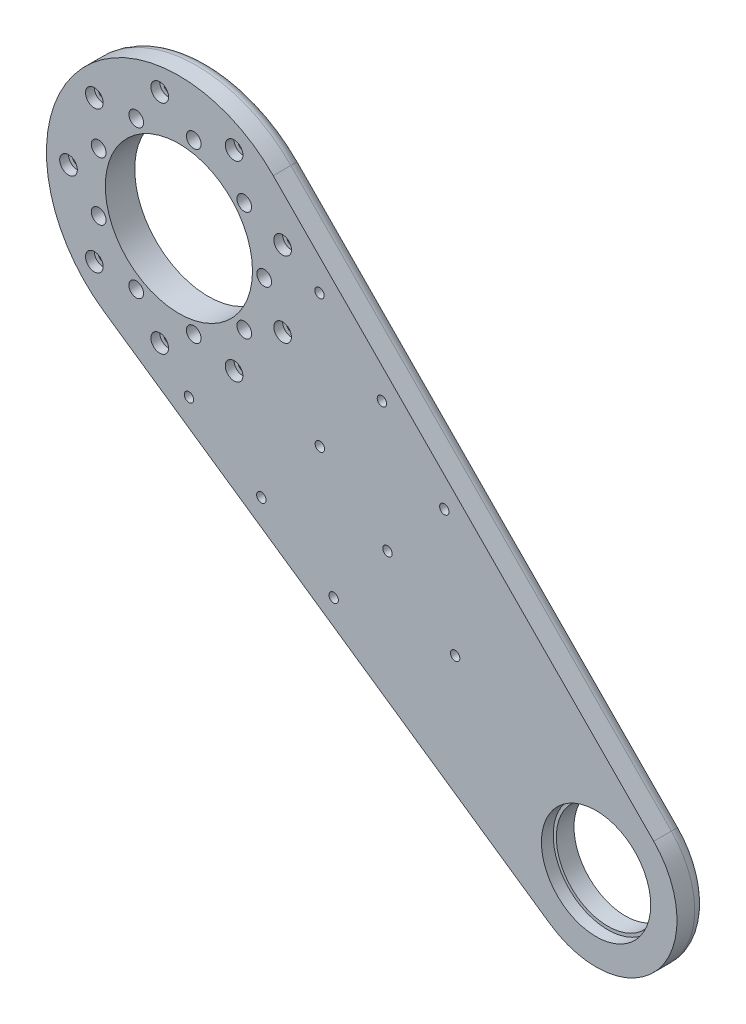
from build123d import *

# Parameters (mm, degrees)
SKETCH1_R           = 17.5
SKETCH1_R_2         = 1.6
BOSS_EXTRUDE1_DEPTH = 10
SKETCH2_R           = 25
SKETCH2_R_2         = 2.5
SKETCH2_R_3         = 1.6
CUT_EXTRUDE1_DEPTH  = 224.991888552
SKETCH3_R           = 18.5625
CUT_EXTRUDE2_DEPTH  = 4
SKETCH4_R           = 3
CUT_EXTRUDE3_DEPTH  = 3
FILLET1_R           = 4


with BuildPart() as part:
    # Sketch1 → Boss-Extrude1 (new body)
    with BuildSketch(Plane.XY):
        with BuildLine():
            Line((-25.534872354, -37.053613776), (126.113577761, -141.559582877))
            ThreePointArc((126.113577761, -141.559582877), (162.784444163, -136.592367058), (161.308367688, -99.616065541))
            Line((161.308367688, -99.616065541), (32.056602073, 31.581232775))
            ThreePointArc((32.056602073, 31.581232775), (-34.47199994, 28.925442436), (-25.534872354, -37.053613776))
        make_face()
        with Locations((141.718221977, -118.915707792)):
            Circle(SKETCH1_R, mode=Mode.SUBTRACT)
        with Locations((70.859110989, -59.457853896)):
            Circle(SKETCH1_R_2, mode=Mode.SUBTRACT)
        with Locations((93.840444282, -78.741482187)):
            Circle(SKETCH1_R_2, mode=Mode.SUBTRACT)
        with Locations((47.877777695, -40.174225605)):
            Circle(SKETCH1_R_2, mode=Mode.SUBTRACT)
        with Locations((47.767990244, 4.946625931)):
            Circle(SKETCH1_R_2, mode=Mode.SUBTRACT)
        with Locations((3.423348889, -47.901259716)):
            Circle(SKETCH1_R_2, mode=Mode.SUBTRACT)
        with Locations((68.973861607, -16.273907044)):
            Circle(SKETCH1_R_2, mode=Mode.SUBTRACT)
        with Locations((90.17973297, -37.494440018)):
            Circle(SKETCH1_R_2, mode=Mode.SUBTRACT)
        with Locations((28.003855203, -65.100059364)):
            Circle(SKETCH1_R_2, mode=Mode.SUBTRACT)
        with Locations((52.584361518, -82.298859012)):
            Circle(SKETCH1_R_2, mode=Mode.SUBTRACT)
    extrude(amount=BOSS_EXTRUDE1_DEPTH)

    # Sketch2 → Cut-Extrude1 (cut, through all)
    with BuildSketch(Plane.XY.offset(10)):
        Circle(SKETCH2_R)
        with Locations((29, 0)):
            Circle(SKETCH2_R_2)
        with Locations((-37.5, 0)):
            Circle(SKETCH2_R_3)
        with Locations((-28.726666617, 24.104535363)):
            Circle(SKETCH2_R_3)
        with Locations((-6.511806663, 36.930290738)):
            Circle(SKETCH2_R_3)
        with Locations((18.75, 32.475952642)):
            Circle(SKETCH2_R_3)
        with Locations((35.238473279, 12.825755375)):
            Circle(SKETCH2_R_3)
        with Locations((35.238473279, -12.825755375)):
            Circle(SKETCH2_R_3)
        with Locations((18.75, -32.475952642)):
            Circle(SKETCH2_R_3)
        with Locations((-6.511806663, -36.930290738)):
            Circle(SKETCH2_R_3)
        with Locations((-28.726666617, -24.104535363)):
            Circle(SKETCH2_R_3)
        with Locations((22.21528885, -18.640840681)):
            Circle(SKETCH2_R_2)
        with Locations((5.035797152, -28.559424837)):
            Circle(SKETCH2_R_2)
        with Locations((-14.5, -25.11473671)):
            Circle(SKETCH2_R_2)
        with Locations((-27.251086003, -9.918584156)):
            Circle(SKETCH2_R_2)
        with Locations((-27.251086003, 9.918584156)):
            Circle(SKETCH2_R_2)
        with Locations((-14.5, 25.11473671)):
            Circle(SKETCH2_R_2)
        with Locations((5.035797152, 28.559424837)):
            Circle(SKETCH2_R_2)
        with Locations((22.21528885, 18.640840681)):
            Circle(SKETCH2_R_2)
    extrude(amount=-CUT_EXTRUDE1_DEPTH, mode=Mode.SUBTRACT)

    # Sketch3 → Cut-Extrude2 (cut)
    with BuildSketch(Plane.XY.offset(10)):
        with Locations((141.718221977, -118.915707792)):
            Circle(SKETCH3_R)
    extrude(amount=-CUT_EXTRUDE2_DEPTH, mode=Mode.SUBTRACT)

    # Sketch4 → Cut-Extrude3 (cut)
    with BuildSketch(Plane.XY.offset(10)):
        with Locations((-28.726666617, 24.104535363)):
            Circle(SKETCH4_R)
        with Locations((-6.511806663, 36.930290738)):
            Circle(SKETCH4_R)
        with Locations((18.75, 32.475952642)):
            Circle(SKETCH4_R)
        with Locations((35.238473279, 12.825755375)):
            Circle(SKETCH4_R)
        with Locations((35.238473279, -12.825755375)):
            Circle(SKETCH4_R)
        with Locations((18.75, -32.475952642)):
            Circle(SKETCH4_R)
        with Locations((-6.511806663, -36.930290738)):
            Circle(SKETCH4_R)
        with Locations((-28.726666617, -24.104535363)):
            Circle(SKETCH4_R)
        with Locations((-37.5, 0)):
            Circle(SKETCH4_R)
    extrude(amount=-CUT_EXTRUDE3_DEPTH, mode=Mode.SUBTRACT)

    # Fillet1
    fillet1_edges = [part.edges().sort_by_distance(p)[0] for p in [
        (162.784444163, -136.592367058, 0),
        (50.289352703, -89.306598327, 0),
        (-34.47199994, 28.925442436, 0),
        (96.68248488, -34.017416383, 0),
    ]]
    fillet(fillet1_edges, radius=FILLET1_R)


solid = part.part
